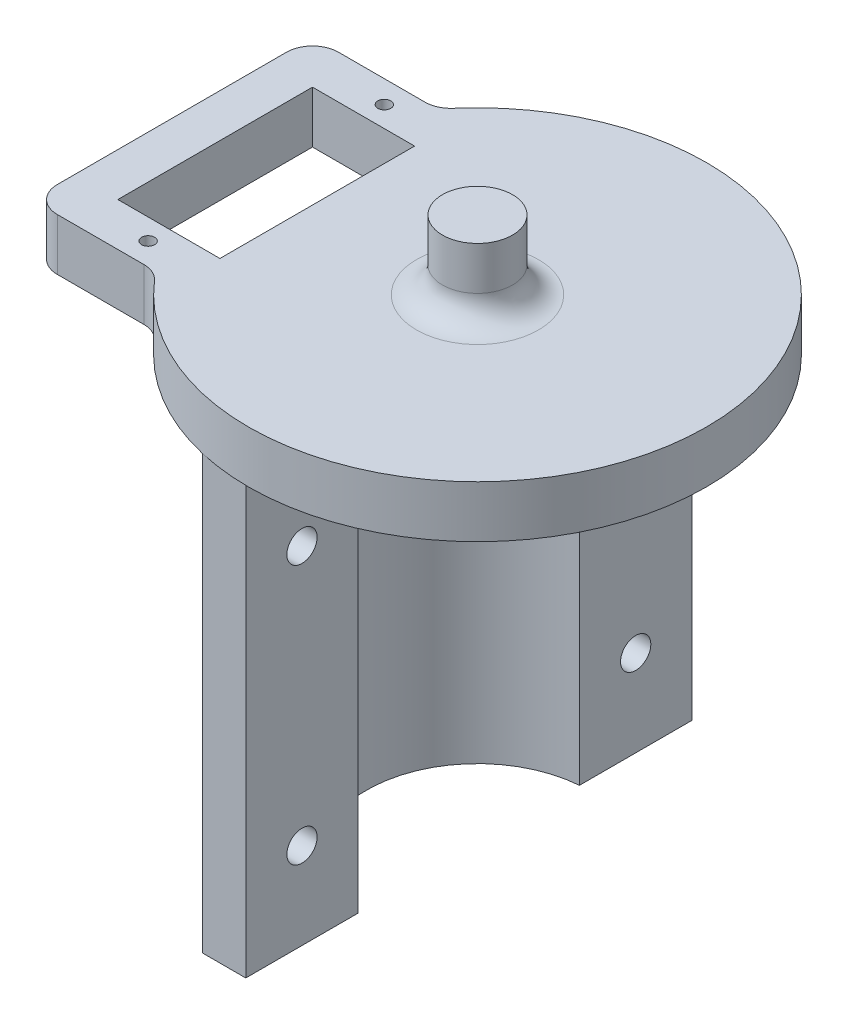
from build123d import *

# Parameters (mm, degrees)
BOSS_EXTRUDE4_DEPTH = 50
SKETCH7_R           = 1.75
CUT_EXTRUDE1_DEPTH  = 59.719147195
SKETCH8_R           = 0.75
SKETCH8_W           = 11.8
SKETCH8_H           = 22.5
BOSS_EXTRUDE5_DEPTH = 6
SKETCH9_R           = 4.05
BOSS_EXTRUDE6_DEPTH = 8
FILLET1_R           = 3


with BuildPart() as part:
    # Sketch6 → Boss-Extrude4 (new body)
    with BuildSketch(Plane.XZ):
        with BuildLine():
            Line((-1, 25.784833184), (-1, 12.785954208))
            ThreePointArc((-1, 12.785954208), (-12.825, 0), (-1, -12.785954208))
            Line((-1, -12.785954208), (-1, -25.784833184))
            Line((-1, -25.784833184), (-6, -25.784833184))
            Line((-6, -25.784833184), (-6, -16.784833184))
            ThreePointArc((-6, -16.784833184), (-17.825, 0), (-6, 16.784833184))
            Line((-6, 16.784833184), (-6, 25.784833184))
            Line((-6, 25.784833184), (-1, 25.784833184))
        make_face()
    extrude(amount=BOSS_EXTRUDE4_DEPTH)

    # Sketch7 → Cut-Extrude1 (cut, through all)
    with BuildSketch(Plane(origin=(-1, 0, 0), x_dir=(0, 0, -1), z_dir=(1, 0, 0))):
        with Locations((-19.285393696, -10)):
            Circle(SKETCH7_R)
        with Locations((-19.285393696, -40)):
            Circle(SKETCH7_R)
        with Locations((19.285393696, -40)):
            Circle(SKETCH7_R)
        with Locations((19.285393696, -10)):
            Circle(SKETCH7_R)
    extrude(amount=-CUT_EXTRUDE1_DEPTH, mode=Mode.SUBTRACT)

    # Sketch8 → Boss-Extrude5 (add)
    with BuildSketch(Plane(origin=(0, 0, 0), x_dir=(1, 0, 0), z_dir=(0, 1, 0))):
        with BuildLine():
            Line((-32.320841509, -16.25), (-22.318992281, -16.25))
            ThreePointArc((-22.318992281, -16.25), (-21.069616181, -16.522536094), (-20.047240136, -17.290627093))
            ThreePointArc((-20.047240136, -17.290627093), (26.473715688, 0), (-20.047240136, 17.290627093))
            ThreePointArc((-20.047240136, 17.290627093), (-21.069616181, 16.522536094), (-22.318992281, 16.25))
            Line((-22.318992281, 16.25), (-32.320841509, 16.25))
            ThreePointArc((-32.320841509, 16.25), (-34.442161852, 15.371320344), (-35.320841509, 13.25))
            Line((-35.320841509, 13.25), (-35.320841509, -13.25))
            ThreePointArc((-35.320841509, -13.25), (-34.442161852, -15.371320344), (-32.320841509, -16.25))
        make_face()
        with Locations((-24.420841509, 13.65)):
            Circle(SKETCH8_R, mode=Mode.SUBTRACT)
        with Locations((-24.420841509, -13.65)):
            Circle(SKETCH8_R, mode=Mode.SUBTRACT)
        with Locations((-24.420841509, 0)):
            Rectangle(SKETCH8_W, SKETCH8_H, mode=Mode.SUBTRACT)
    extrude(amount=BOSS_EXTRUDE5_DEPTH)

    # Sketch9 → Boss-Extrude6 (add)
    with BuildSketch(Plane(origin=(0, 6, 0), x_dir=(1, 0, 0), z_dir=(0, 1, 0))):
        Circle(SKETCH9_R)
    extrude(amount=BOSS_EXTRUDE6_DEPTH)

    # Fillet1
    fillet1_edges = [part.edges().sort_by_distance(p)[0] for p in [
        (-4.05, 6, 0),
    ]]
    fillet(fillet1_edges, radius=FILLET1_R)


solid = part.part
